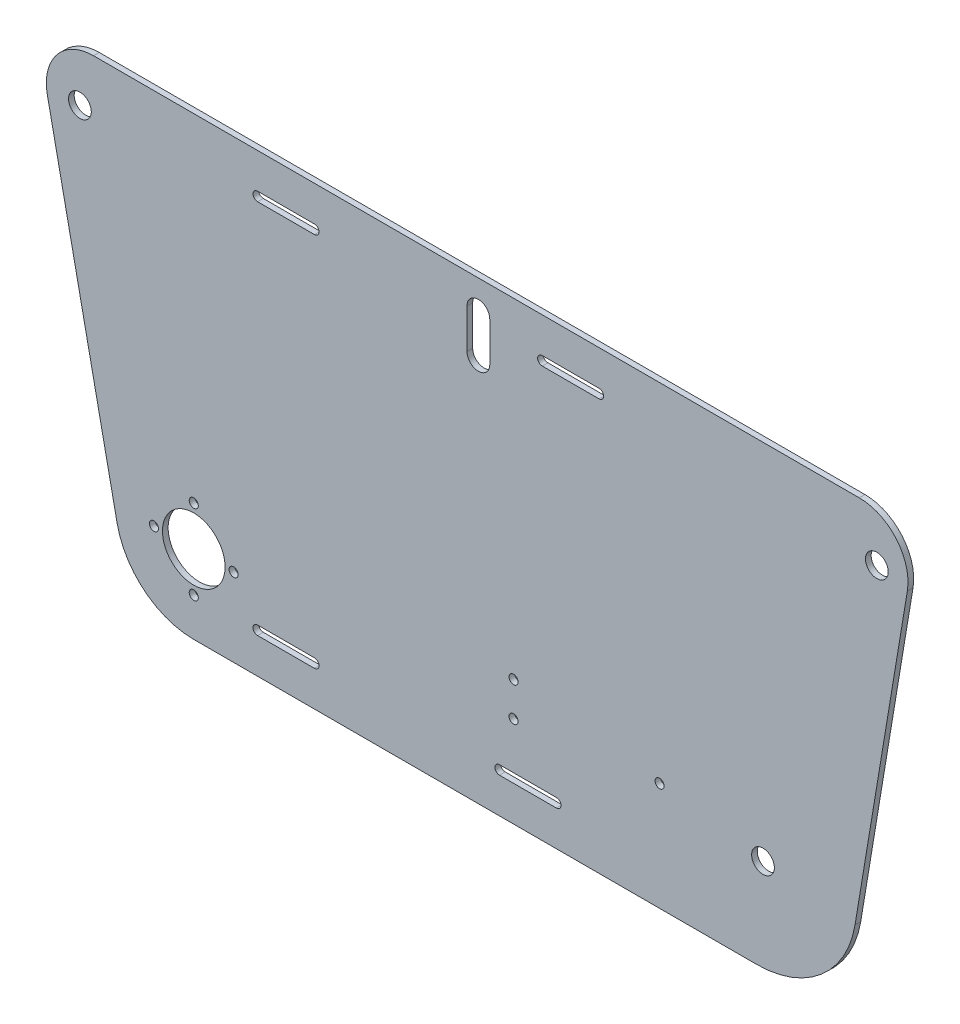
from build123d import *

# Parameters (mm, degrees)
SKETCH3_R           = 1.6
SKETCH3_R_2         = 11
SKETCH3_R_3         = 4
BOSS_EXTRUDE1_DEPTH = 2
CUT_EXTRUDE3_DEPTH  = 202.525833861


with BuildPart() as part:
    # Sketch3 → Boss-Extrude1 (new body)
    with BuildSketch(Plane.XY):
        with BuildLine():
            ThreePointArc((-126.925740619, -5.558827984), (-117.356688592, -21.298876537), (-100, -27.468256266))
            Line((-100, -27.468256266), (97.771410342, -27.468256266))
            ThreePointArc((97.771410342, -27.468256266), (120.43275171, -19.155269629), (132.342869895, 1.839758932))
            Line((132.342869895, 1.839758932), (150.718078468, 112.587537538))
            ThreePointArc((150.718078468, 112.587537538), (146.883625567, 126.475757693), (133.810342842, 132.531743734))
            Line((133.810342842, 132.531743734), (-135.227817714, 132.531743734))
            ThreePointArc((-135.227817714, 132.531743734), (-148.084116861, 126.418210974), (-151.456383586, 112.587537538))
            Line((-151.456383586, 112.587537538), (-126.925740619, -5.558827984))
        make_face()
        with Locations((-100, -13.968256266)):
            Circle(SKETCH3_R, mode=Mode.SUBTRACT)
        with Locations((-114, 0.031743734)):
            Circle(SKETCH3_R, mode=Mode.SUBTRACT)
        with Locations((-100, 0.031743734)):
            Circle(SKETCH3_R_2, mode=Mode.SUBTRACT)
        with Locations((-86, 0.031743734)):
            Circle(SKETCH3_R, mode=Mode.SUBTRACT)
        with Locations((-100, 14.031743734)):
            Circle(SKETCH3_R, mode=Mode.SUBTRACT)
        with Locations((12.357913989, 4.531743734)):
            Circle(SKETCH3_R, mode=Mode.SUBTRACT)
        with Locations((63.65613527, 10.531743734)):
            Circle(SKETCH3_R, mode=Mode.SUBTRACT)
        with Locations((100, 5.031743734)):
            Circle(SKETCH3_R_3, mode=Mode.SUBTRACT)
        with Locations((12.357913989, 16.531743734)):
            Circle(SKETCH3_R, mode=Mode.SUBTRACT)
        with Locations((-140, 115.061965544)):
            Circle(SKETCH3_R_3, mode=Mode.SUBTRACT)
        with BuildLine():
            Line((-4, 115.061965561), (-4, 121.990168775))
            ThreePointArc((-4, 121.990168775), (0, 125.990168775), (4, 121.990168775))
            Line((4, 121.990168775), (4, 115.061965544))
            Line((4, 115.061965544), (4, 108.133762314))
            ThreePointArc((4, 108.133762314), (0, 104.133762314), (-4, 108.133762314))
            Line((-4, 108.133762314), (-4, 115.061965561))
        make_face(mode=Mode.SUBTRACT)
        with Locations((140, 115.061965544)):
            Circle(SKETCH3_R_3, mode=Mode.SUBTRACT)
    extrude(amount=BOSS_EXTRUDE1_DEPTH)

    # Sketch6 → Cut-Extrude3 (cut, through all)
    with BuildSketch(Plane.XY):
        with BuildLine():
            Line((-77.58, -11.868256266), (-57.58, -11.868256266))
            ThreePointArc((-57.58, -11.868256266), (-55.98, -13.468256266), (-57.58, -15.068256266))
            Line((-57.58, -15.068256266), (-77.58, -15.068256266))
            ThreePointArc((-77.58, -15.068256266), (-79.18, -13.468256266), (-77.58, -11.868256266))
        make_face()
        with BuildLine():
            Line((7.42, -11.868256266), (27.42, -11.868256266))
            ThreePointArc((27.42, -11.868256266), (29.02, -13.468256266), (27.42, -15.068256266))
            Line((27.42, -15.068256266), (7.42, -15.068256266))
            ThreePointArc((7.42, -15.068256266), (5.82, -13.468256266), (7.42, -11.868256266))
        make_face()
        with BuildLine():
            Line((-77.58, 120.131743734), (-57.58, 120.131743734))
            ThreePointArc((-57.58, 120.131743734), (-55.98, 118.531743734), (-57.58, 116.931743734))
            Line((-57.58, 116.931743734), (-77.58, 116.931743734))
            ThreePointArc((-77.58, 116.931743734), (-79.18, 118.531743734), (-77.58, 120.131743734))
        make_face()
        with BuildLine():
            Line((22.42, 120.131743734), (42.42, 120.131743734))
            ThreePointArc((42.42, 120.131743734), (44.02, 118.531743734), (42.42, 116.931743734))
            Line((42.42, 116.931743734), (22.42, 116.931743734))
            ThreePointArc((22.42, 116.931743734), (20.82, 118.531743734), (22.42, 120.131743734))
        make_face()
    extrude(amount=CUT_EXTRUDE3_DEPTH, mode=Mode.SUBTRACT)


solid = part.part
